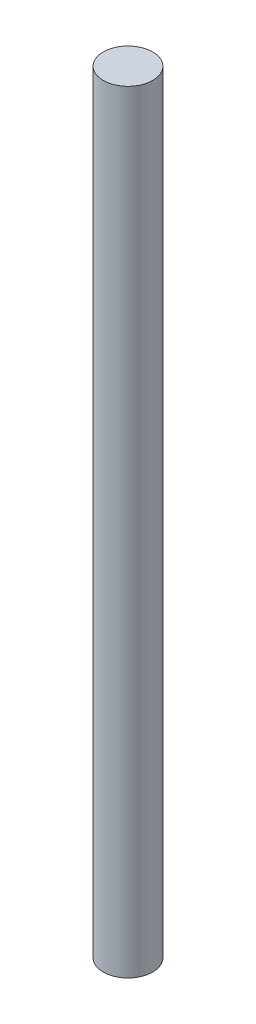
from build123d import *

# Parameters (mm, degrees)
SKETCH1_R           = 4
BOSS_EXTRUDE1_DEPTH = 125


with BuildPart() as part:
    # Sketch1 → Boss-Extrude1 (new body)
    with BuildSketch(Plane(origin=(0, 0, 0), x_dir=(1, 0, 0), z_dir=(0, 1, 0))):
        Circle(SKETCH1_R)
    extrude(amount=BOSS_EXTRUDE1_DEPTH)


solid = part.part
